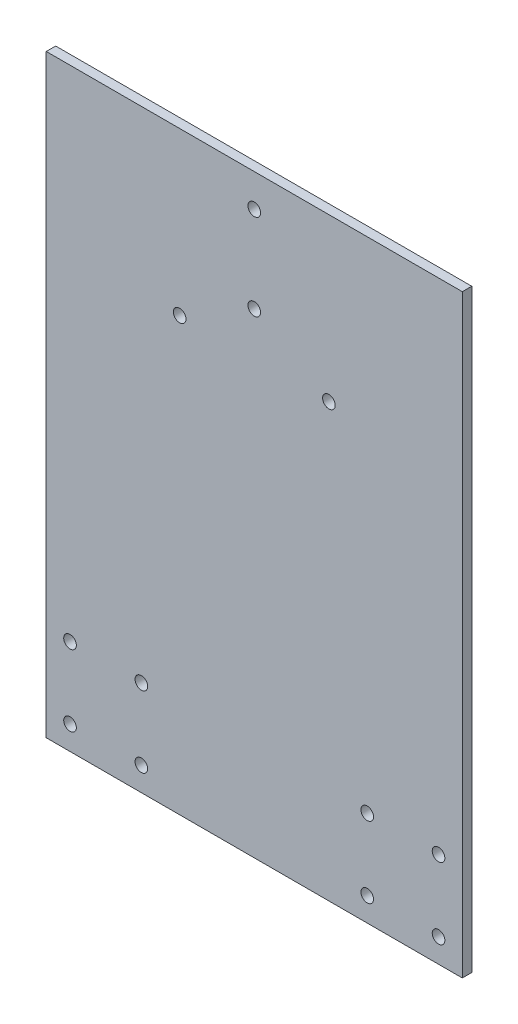
from build123d import *

# Parameters (mm, degrees)
SKETCH1_W           = 140
SKETCH1_H           = 200
SKETCH1_R           = 2.125
BOSS_EXTRUDE1_DEPTH = 3.175


with BuildPart() as part:
    # Sketch1 → Boss-Extrude1 (new body)
    with BuildSketch(Plane.XY):
        Rectangle(SKETCH1_W, SKETCH1_H)
        with Locations((0, 89)):
            Circle(SKETCH1_R, mode=Mode.SUBTRACT)
        with Locations((25.11473671, 45.5)):
            Circle(SKETCH1_R, mode=Mode.SUBTRACT)
        with Locations((-25.11473671, 45.5)):
            Circle(SKETCH1_R, mode=Mode.SUBTRACT)
        with Locations((0, 60)):
            Circle(SKETCH1_R, mode=Mode.SUBTRACT)
        with Locations((-62, -92)):
            Circle(SKETCH1_R, mode=Mode.SUBTRACT)
        with Locations((-38, -92)):
            Circle(SKETCH1_R, mode=Mode.SUBTRACT)
        with Locations((-38, -68)):
            Circle(SKETCH1_R, mode=Mode.SUBTRACT)
        with Locations((-62, -68)):
            Circle(SKETCH1_R, mode=Mode.SUBTRACT)
        with Locations((38, -92)):
            Circle(SKETCH1_R, mode=Mode.SUBTRACT)
        with Locations((62, -92)):
            Circle(SKETCH1_R, mode=Mode.SUBTRACT)
        with Locations((62, -68)):
            Circle(SKETCH1_R, mode=Mode.SUBTRACT)
        with Locations((38, -68)):
            Circle(SKETCH1_R, mode=Mode.SUBTRACT)
    extrude(amount=BOSS_EXTRUDE1_DEPTH)


solid = part.part
